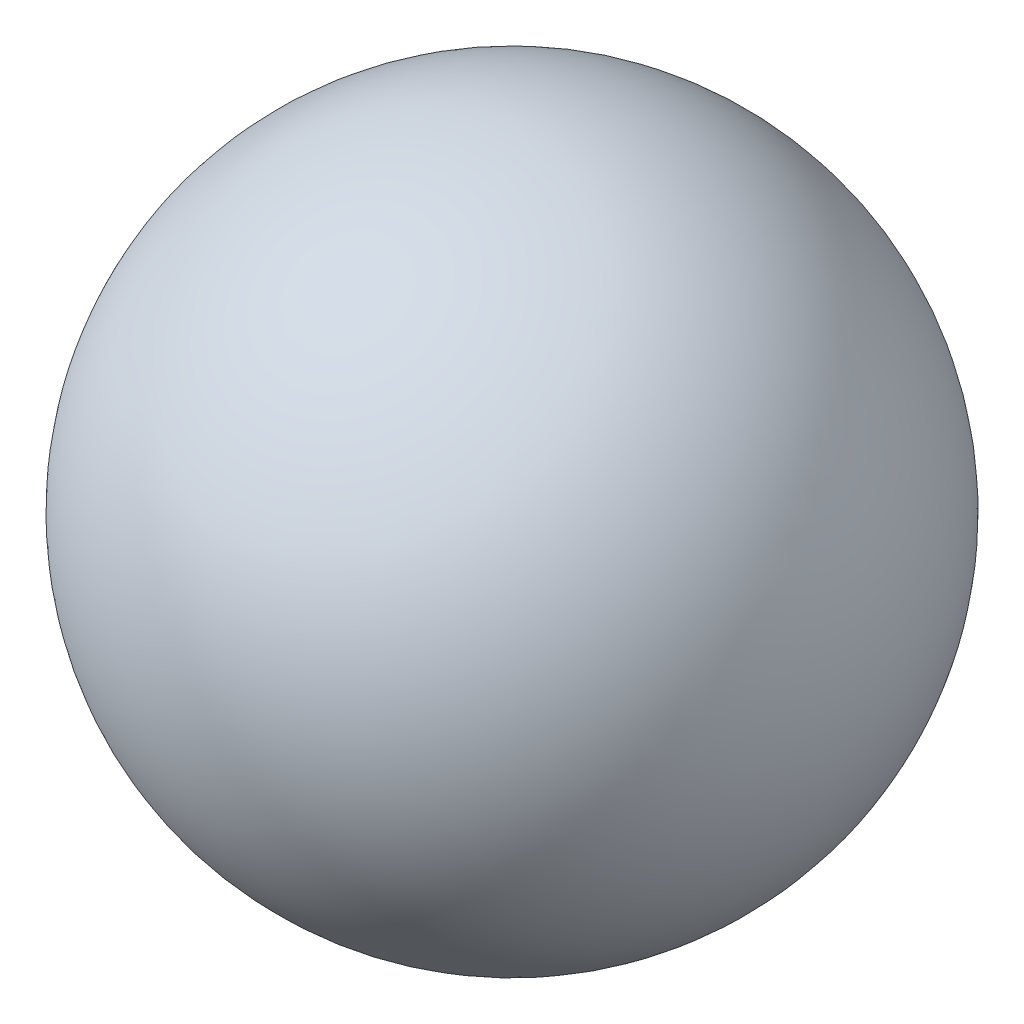
from build123d import *

# Parameters (mm, degrees)
SKETCH1_W           = 200
SKETCH1_H           = 200
BOSS_EXTRUDE1_DEPTH = 850
SKETCH2_R           = 3
CUT_EXTRUDE1_DEPTH  = 10


with BuildPart() as part:
    # Sketch1 → Boss-Extrude1 (new body)
    with BuildSketch(Plane(origin=(0, 0, 0), x_dir=(1, 0, 0), z_dir=(0, 1, 0))):
        with Locations((100, 100)):
            Rectangle(SKETCH1_W, SKETCH1_H)
    extrude(amount=BOSS_EXTRUDE1_DEPTH)

    # Sketch2 → Cut-Extrude1 (cut)
    with BuildSketch(Plane(origin=(0, 850, 0), x_dir=(1, 0, 0), z_dir=(0, 1, 0))):
        with Locations((100, 161.5)):
            Circle(SKETCH2_R)
        with Locations((161.5, 100)):
            Circle(SKETCH2_R)
        with Locations((100, 38.5)):
            Circle(SKETCH2_R)
        with Locations((38.5, 100)):
            Circle(SKETCH2_R)
    extrude(amount=-CUT_EXTRUDE1_DEPTH, mode=Mode.SUBTRACT)

    # Sketch3 → Revolve1 (revolve)
    with BuildSketch(Plane(origin=(0, 850, 0), x_dir=(1, 0, 0), z_dir=(0, 1, 0))):
        with BuildLine():
            Line((-1713, 100), (1913, 100))
            ThreePointArc((1913, 100), (100, -1713), (-1713, 100))
        make_face()
    revolve(axis=Axis((-1713, 850, -100), (1, 0, 0)))


solid = part.part
